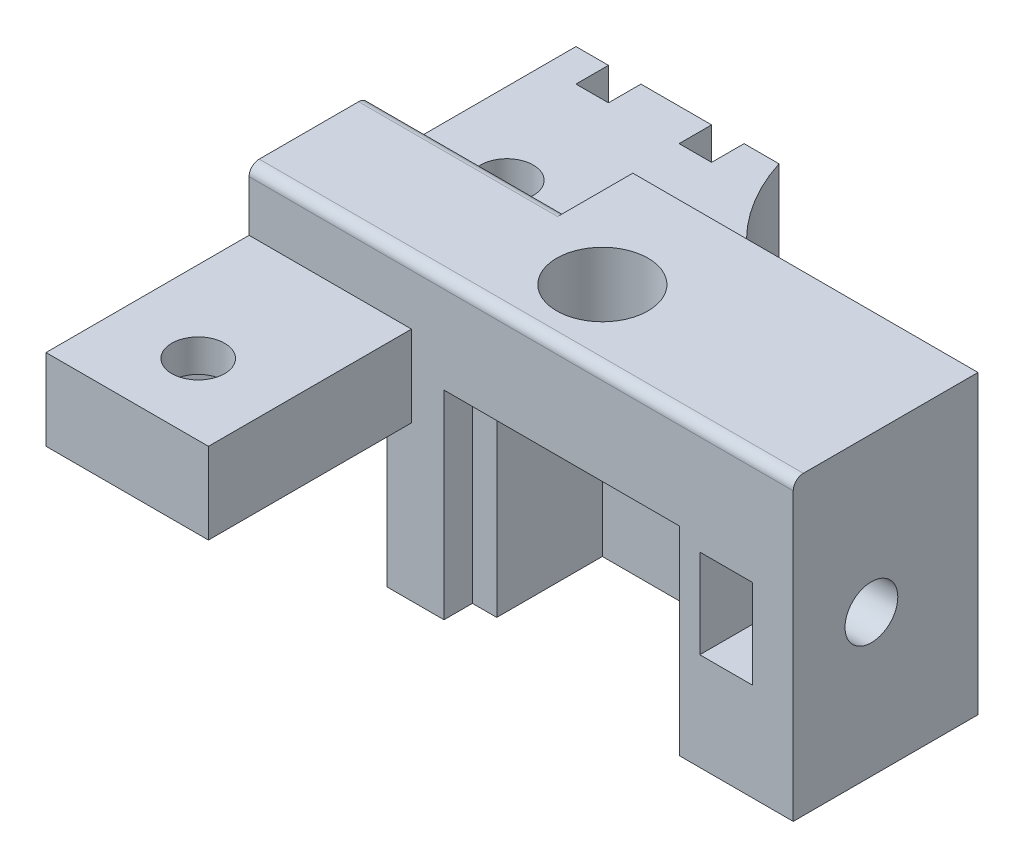
from build123d import *

# Parameters (mm, degrees)
SKETCH2_W                = 10
SKETCH2_H                = 7.3
BOSS_EXTRUDE1_DEPTH      = 4.55
SKETCH3_W                = 4.6
SKETCH3_H                = 4.9
CUT_EXTRUDE1_DEPTH       = 3.3
BOSS_EXTRUDE2_DEPTH      = 9.55
BOSS_EXTRUDE2_DEPTH_BACK = 2.7
SKETCH5_W                = 4
SKETCH5_H                = 2
BOSS_EXTRUDE3_REACH      = 19.417
SKETCH13_W               = 5
SKETCH13_H               = 2
SKETCH6_W                = 1.74
SKETCH6_H                = 2
SKETCH6_W_2              = 0.86
SKETCH6_W_3              = 0.8
BOSS_EXTRUDE4_DEPTH      = 0.8
FILLET1_R                = 5
CUT_EXTRUDE2_DEPTH       = 1.2
SKETCH8_R                = 0.65
CUT_EXTRUDE3_DEPTH       = 15.703826033
SKETCH9_R                = 1.125
CUT_EXTRUDE4_DEPTH       = 15.670122699
CUT_EXTRUDE5_REACH       = 20.001
SKETCH10_R               = 0.65
CUT_EXTRUDE6_DEPTH       = 1.3
SKETCH14_W               = 3.4
SKETCH14_H               = 2.947905619
BOSS_EXTRUDE6_DEPTH      = 1.5
SKETCH15_W               = 1.5
SKETCH15_H               = 1.602094381
CUT_EXTRUDE7_DEPTH       = 1.5
FILLET2_R                = 0.25
SKETCH16_W               = 5.8
SKETCH16_H               = 4.9
CUT_EXTRUDE8_DEPTH       = 0.7


with BuildPart() as part:
    # Sketch2 → Boss-Extrude1 (new body)
    with BuildSketch(Plane.XY):
        with Locations((5, 3.65)):
            Rectangle(SKETCH2_W, SKETCH2_H)
    extrude(amount=BOSS_EXTRUDE1_DEPTH)

    # Sketch3 → Cut-Extrude1 (cut)
    with BuildSketch(Plane.XY.offset(4.55)):
        with Locations((4.3, 2.45)):
            Rectangle(SKETCH3_W, SKETCH3_H)
    extrude(amount=-CUT_EXTRUDE1_DEPTH, mode=Mode.SUBTRACT)

    # Sketch5 → Boss-Extrude2 (add, two sides: drawn at the far end of the back side and taken through both)
    with BuildSketch(Plane.XY.offset(-BOSS_EXTRUDE2_DEPTH_BACK)):
        with Locations((-1.4, 4.8)):
            Rectangle(SKETCH5_W, SKETCH5_H)
    extrude(amount=BOSS_EXTRUDE2_DEPTH + BOSS_EXTRUDE2_DEPTH_BACK)

    # Sketch13 → Boss-Extrude3 (add, up to next)
    with BuildSketch(Plane(origin=(0, 0, -2.7), x_dir=(-1, 0, 0), z_dir=(0, 0, -1)), mode=Mode.PRIVATE) as boss_extrude3_sk1:
        with Locations((0.9, 4.8)):
            Rectangle(SKETCH13_W, SKETCH13_H)
    boss_extrude3_tool1 = extrude(boss_extrude3_sk1.sketch, amount=-BOSS_EXTRUDE3_REACH, mode=Mode.PRIVATE) - part.part
    add(boss_extrude3_tool1.solids().sort_by_distance((-0.9, 4.8, -2.7))[0])

    # Sketch6 → Boss-Extrude4 (add)
    with BuildSketch(Plane(origin=(0, 0, -2.7), x_dir=(-1, 0, 0), z_dir=(0, 0, -1))):
        with Locations((0.93, 4.8)):
            Rectangle(SKETCH6_W, SKETCH6_H)
        with Locations((-1.17, 4.8)):
            Rectangle(SKETCH6_W_2, SKETCH6_H)
        with Locations((3, 4.8)):
            Rectangle(SKETCH6_W_3, SKETCH6_H)
    extrude(amount=BOSS_EXTRUDE4_DEPTH)

    # Fillet1
    # the kernel refuses this fillet: 5 mm, written as the material it adds along each edge
    with BuildSketch(Plane(origin=(1.6, 3.8, 0), x_dir=(0, 0, -1), z_dir=(0, 1, 0))) as fillet1_piece_1:
        with BuildLine():
            CenterArc((5, -4.769696007), FILLET1_R, 107.457603124, 72.542396876)
            Line((0, -4.769696007), (-0.1, -4.769696007))
            Line((-0.1, -4.769696007), (-0.1, 0))
            Line((-0.1, 0), (0, 0.1))
            ThreePointArc((0, 0.1), (1.75, 0.1), (3.47, 0.09539392))
            Line((3.47, 0.09539392), (3.5, 0))
        make_face()
    extrude(amount=2)

    # Sketch7 → Cut-Extrude2 (cut)
    with BuildSketch(Plane(origin=(0, 3.8, 0), x_dir=(-1, 0, 0), z_dir=(0, -1, 0))):
        Polygon((0.25, -7.138141571), (0.25, -8.46604719), (1.4, -9.13), (2.55, -8.46604719), (2.55, -7.138141571), (1.4, -6.474188762), align=None)
        Polygon((1.4, 1.125811238), (0.25, 0.461858429), (0.25, -0.86604719), (1.4, -1.53), (2.55, -0.86604719), (2.55, 0.461858429), align=None)
    extrude(amount=-CUT_EXTRUDE2_DEPTH, mode=Mode.SUBTRACT)

    # Sketch8 → Cut-Extrude3 (cut, through all)
    with BuildSketch(Plane.XZ.offset(-5)):
        with Locations(Location((-1.4, 7.802094381, 0), (0, 0, 270))):
            Circle(SKETCH8_R)
        with Locations(Location((-1.4, 0.202094381, 0), (0, 0, 270))):
            Circle(SKETCH8_R)
    extrude(amount=-CUT_EXTRUDE3_DEPTH, mode=Mode.SUBTRACT)

    # Sketch9 → Cut-Extrude4 (cut, through all)
    with BuildSketch(Plane.XZ.offset(-4.9)):
        with Locations(Location((3.5, 2.75, 0), (0, 0, 270))):
            Circle(SKETCH9_R)
    extrude(amount=-CUT_EXTRUDE4_DEPTH, mode=Mode.SUBTRACT)

    # Sketch10 → Cut-Extrude5 (cut, up to next)
    with BuildSketch(Plane(origin=(10, 0, 0), x_dir=(0, 0, -1), z_dir=(1, 0, 0)), mode=Mode.PRIVATE) as cut_extrude5_sk1:
        with Locations((-2.625, 3.5)):
            Circle(SKETCH10_R)
    cut_extrude5_tool1 = extrude(cut_extrude5_sk1.sketch, amount=-CUT_EXTRUDE5_REACH, mode=Mode.PRIVATE) & part.part
    add(cut_extrude5_tool1.solids().sort_by_distance((10, 3.5, 2.625))[0], mode=Mode.SUBTRACT)

    # Sketch12 → Cut-Extrude6 (cut)
    with BuildSketch(Plane(origin=(9, 0, 0), x_dir=(0, 0, -1), z_dir=(1, 0, 0))):
        Polygon((-3.257198545, 2.405), (-4.55, 2.405), (-4.55, 4.595), (-3.257198545, 4.595), (-1.992801455, 4.595), (-1.36060291, 3.5), (-1.992801455, 2.405), align=None)
    extrude(amount=-CUT_EXTRUDE6_DEPTH, mode=Mode.SUBTRACT)

    # Sketch14 → Boss-Extrude6 (add)
    with BuildSketch(Plane(origin=(0, 5.8, 0), x_dir=(1, 0, 0), z_dir=(0, 1, 0))):
        with Locations((-1.7, -3.076047191)):
            Rectangle(SKETCH14_W, SKETCH14_H)
    extrude(amount=BOSS_EXTRUDE6_DEPTH)

    # Sketch15 → Cut-Extrude7 (cut)
    with BuildSketch(Plane(origin=(0, 7.3, 0), x_dir=(1, 0, 0), z_dir=(0, 1, 0))):
        with Locations((0.75, -0.801047191)):
            Rectangle(SKETCH15_W, SKETCH15_H)
    extrude(amount=-CUT_EXTRUDE7_DEPTH, mode=Mode.SUBTRACT)

    # Fillet2
    fillet2_edges = [part.edges().sort_by_distance(p)[0] for p in [
        (3.3, 7.3, 4.55),
        (-0.95, 7.3, 1.602094381),
    ]]
    fillet(fillet2_edges, radius=FILLET2_R)

    # Sketch16 → Cut-Extrude8 (cut)
    with BuildSketch(Plane.XY.offset(4.55)):
        with Locations((4.3, 2.45)):
            Rectangle(SKETCH16_W, SKETCH16_H)
    extrude(amount=-CUT_EXTRUDE8_DEPTH, mode=Mode.SUBTRACT)


solid = part.part
